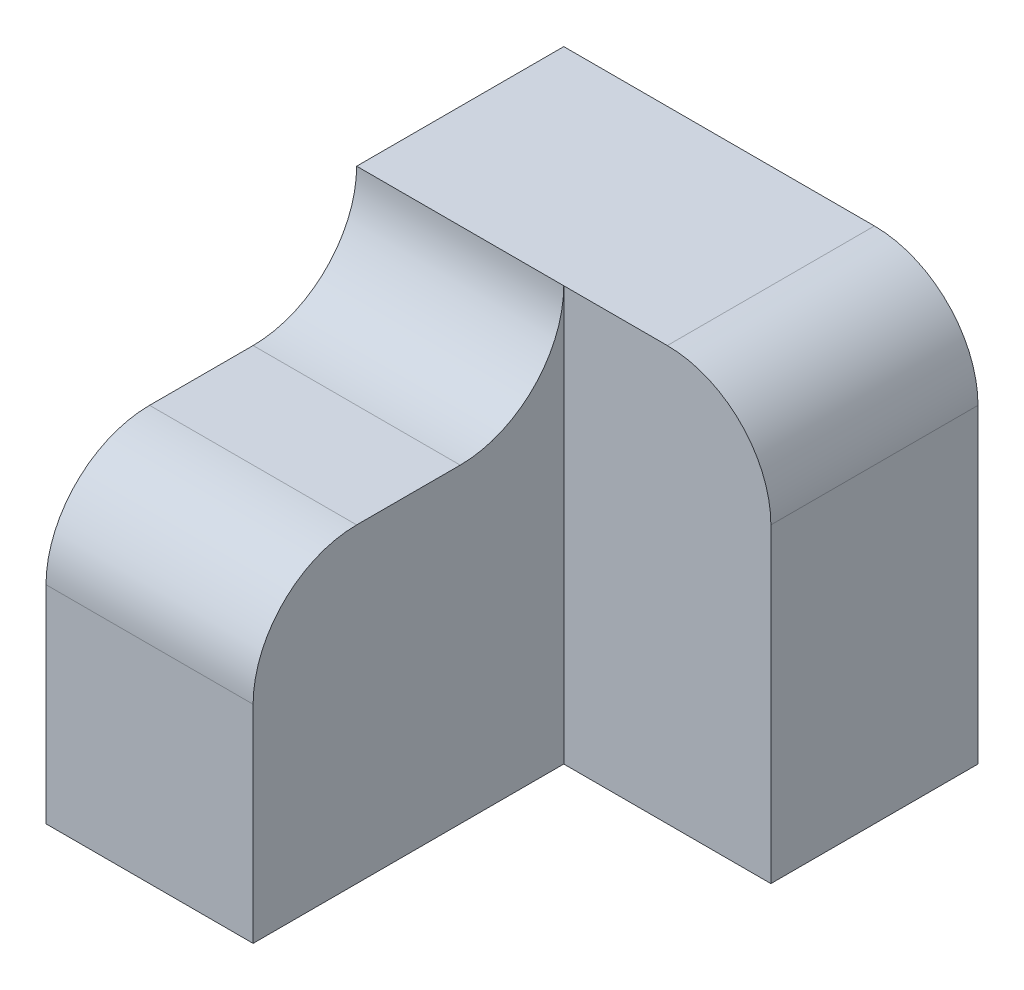
from build123d import *

# Parameters (mm, degrees)
SKETCH1_W           = 20
SKETCH1_H           = 30
BOSS_EXTRUDE1_DEPTH = 30
SKETCH2_W           = 40
SKETCH2_H           = 40
BOSS_EXTRUDE2_DEPTH = 20
FILLET1_R           = 10


with BuildPart() as part:
    # Sketch1 → Boss-Extrude1 (new body)
    with BuildSketch(Plane.XY):
        with Locations((-20, -15)):
            Rectangle(SKETCH1_W, SKETCH1_H)
    extrude(amount=BOSS_EXTRUDE1_DEPTH)

    # Sketch2 → Boss-Extrude2 (add)
    with BuildSketch(Plane.XY):
        with Locations((-10, -10)):
            Rectangle(SKETCH2_W, SKETCH2_H)
    extrude(amount=-BOSS_EXTRUDE2_DEPTH)

    # Fillet1
    fillet1_edges = [part.edges().sort_by_distance(p)[0] for p in [
        (-20, 0, 0),
        (10, 10, -10),
        (-20, 0, 30),
    ]]
    fillet(fillet1_edges, radius=FILLET1_R - 0.0001)  # a hair under: the kernel refuses the full size


solid = part.part
